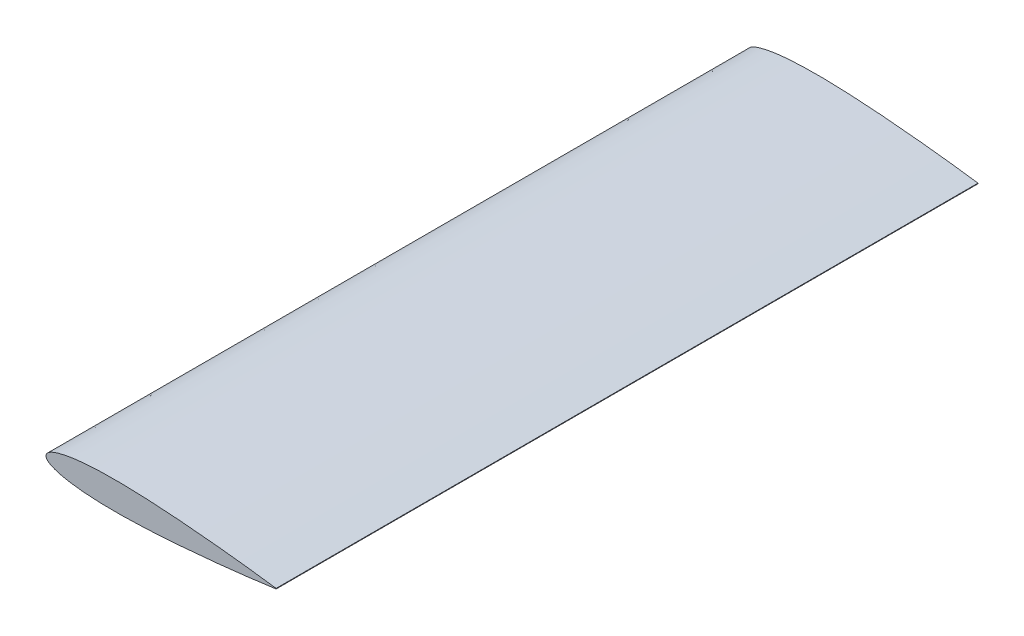
from build123d import *

# Parameters (mm, degrees)
BOSS_EXTRUDE1_DEPTH = 387.35


with BuildPart() as part:
    # Sketch1 → Boss-Extrude1 (new body)
    with BuildSketch(Plane.XY):
        with BuildLine():
            add(Edge.make_bspline(
                [(0, 0), (0.014787865, 0.182587172), (0.045123671, 0.55714623), (0.289202643, 1.100069783), (0.669802119, 1.622596804), (1.198397925, 2.126995195), (1.868214507, 2.615036608), (2.679912557, 3.087187348), (3.631773923, 3.542910961), (4.72228138, 3.981174419), (5.9492174, 4.400673225), (7.309980177, 4.800001969), (8.801569684, 5.177656177), (10.420601695, 5.532264857), (12.163391416, 5.862371278), (14.025910152, 6.166774382), (16.003859242, 6.444224905), (18.092638105, 6.693786188), (20.287392365, 6.914566798), (22.583004305, 7.105952415), (24.974124891, 7.267500336), (27.455183748, 7.398939329), (30.020387925, 7.50029876), (32.6637483, 7.571768113), (35.37909603, 7.613737924), (38.16009598, 7.6268579), (41.000252855, 7.611912582), (43.892935104, 7.569879311), (46.831388406, 7.501897019), (49.80875771, 7.409257979), (52.818088887, 7.293315259), (55.852352747, 7.155560507), (58.904465333, 6.997557268), (62.989718699, 6.76192592), (67.07428575, 6.492791876), (72.153153866, 6.122085821), (77.161565564, 5.723570073), (82.115167215, 5.291274037), (86.928545971, 4.846337775), (91.556695876, 4.396255017), (96.074209839, 3.930282916), (100.342395257, 3.472307631), (104.321343716, 3.029895637), (108.800275666, 2.509782412), (112.856241075, 2.01993467), (115.953937365, 1.632470119), (118.192651038, 1.345627894), (120.454508393, 1.051537975), (122.982051787, 0.715008334), (125.183869328, 0.413145258), (126.383583987, 0.246336664), (126.777898618, 0.191178133), (127, 0.16002)],
                knots=[0, 0, 0, 0, 0.004217542, 0.008651859, 0.013562306, 0.019137014, 0.025499556, 0.032726168, 0.040861643, 0.049929832, 0.059940125, 0.070891981, 0.082777029, 0.095581153, 0.109285667, 0.123867697, 0.139301078, 0.155556621, 0.172602407, 0.190403892, 0.208924358, 0.228124969, 0.247964735, 0.268400696, 0.289388247, 0.310881146, 0.332831518, 0.355189968, 0.377906083, 0.40092815, 0.424203485, 0.447678538, 0.471299018, 0.495010229, 0.542484027, 0.566135681, 0.61299198, 0.658886484, 0.68133798, 0.724985379, 0.766618503, 0.786556306, 0.824439816, 0.859372048, 0.89102289, 0.919092539, 0.931699726, 0.943314236, 0.971937174, 0.990775422, 0.994803883, 1, 1, 1, 1], degree=3))
            Line((0, 0), (0.0741553, -0.5410581))
            add(Edge.make_bspline(
                [(0.0741553, -0.5410581), (0.140193116, -0.721669288), (0.279359485, -1.102284586), (0.672953866, -1.621887631), (1.197372717, -2.127225876), (1.868546979, -2.614961799), (2.679805959, -3.087211333), (3.631807621, -3.542903378), (4.722270879, -3.981176782), (5.949220629, -4.400672498), (7.309979196, -4.800002189), (8.801569979, -5.177656111), (10.420601607, -5.532264877), (12.163391442, -5.862371272), (14.025910144, -6.166774384), (16.003859244, -6.444224904), (18.092638104, -6.693786188), (20.287392365, -6.914566798), (22.583004305, -7.105952415), (24.974124891, -7.267500336), (27.455183748, -7.398939329), (30.020387925, -7.50029876), (32.6637483, -7.571768113), (35.37909603, -7.613737924), (38.16009598, -7.6268579), (41.000252855, -7.611912582), (43.892935104, -7.569879311), (46.831388406, -7.501897019), (49.80875771, -7.409257979), (52.818088887, -7.293315259), (55.852352747, -7.155560507), (58.904465333, -6.997557268), (62.989718699, -6.76192592), (67.07428575, -6.492791876), (72.153153866, -6.122085821), (77.161565564, -5.723570073), (82.115167215, -5.291274037), (86.928545971, -4.846337775), (91.556695876, -4.396255017), (96.074209839, -3.930282916), (100.342395257, -3.472307631), (104.321343716, -3.029895637), (108.800275666, -2.509782412), (112.856241075, -2.01993467), (115.953937365, -1.632470119), (118.192651038, -1.345627894), (120.454508393, -1.051537975), (122.982051787, -0.715008334), (125.183869328, -0.413145258), (126.383583987, -0.246336664), (126.777898618, -0.191178133), (127, -0.16002)],
                knots=[0, 0, 0, 0, 0.004453098, 0.009384343, 0.014982663, 0.021372152, 0.028629372, 0.036799304, 0.0459059, 0.055958591, 0.066956833, 0.078892219, 0.091750574, 0.105513132, 0.120156922, 0.135655669, 0.151980062, 0.169098043, 0.186974925, 0.205573833, 0.224855766, 0.244779561, 0.265302077, 0.286378518, 0.307962448, 0.330005789, 0.352458937, 0.375271263, 0.398390839, 0.421764754, 0.445339233, 0.469059756, 0.492871393, 0.540546262, 0.56429809, 0.611352844, 0.65744173, 0.679988317, 0.72382058, 0.765630038, 0.785652286, 0.823696247, 0.858776431, 0.890561328, 0.918749863, 0.931410447, 0.943074149, 0.971818317, 0.990736353, 0.994781875, 1, 1, 1, 1], degree=3))
            Line((127, -0.16002), (127, 0.16002))
        make_face()
    extrude(amount=BOSS_EXTRUDE1_DEPTH)


solid = part.part
